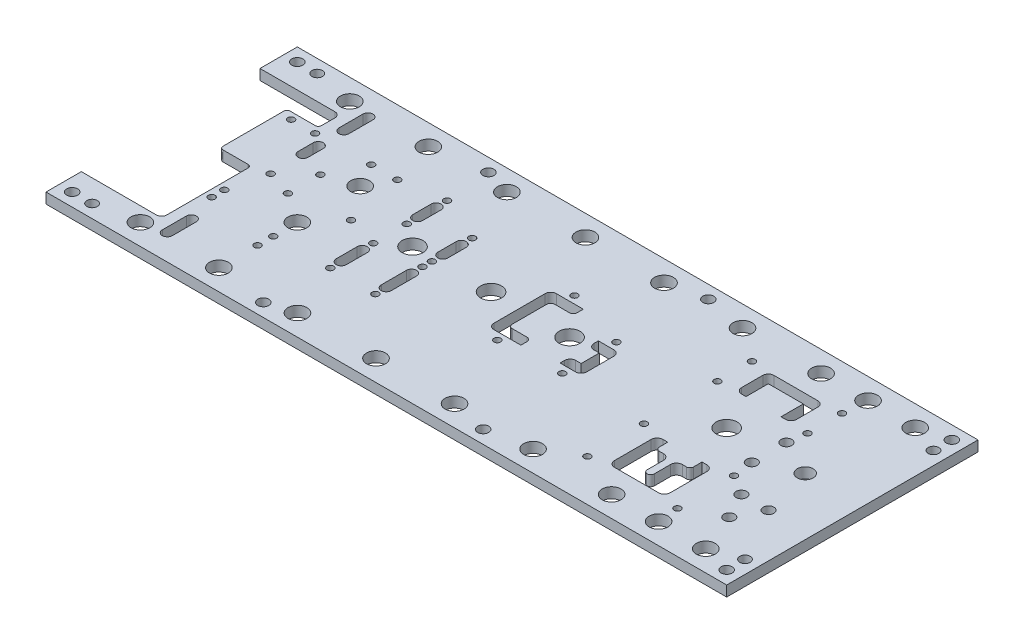
from build123d import *

# Parameters (mm, degrees)
SKETCH1_W                      = 650
SKETCH1_H                      = 240
BOSS_EXTRUDE1_DEPTH            = 10
CUT_EXTRUDE1_REACH             = 348.591
SKETCH2_R                      = 9
SKETCH2_R_2                    = 10
M6_CLEARANCE_HOLE1_D           = 6.4
M6_CLEARANCE_HOLE1_CSINK_D     = 6.45
M6_CLEARANCE_HOLE1_CSINK_ANGLE = 90
CUT_EXTRUDE2_REACH             = 348.591
FILLET1_R                      = 3
CUT_EXTRUDE3_REACH             = 348.591
SKETCH12_R                     = 5.113641914
SKETCH12_R_2                   = 7.613641914
CUT_EXTRUDE4_REACH             = 348.591
CUT_EXTRUDE5_REACH             = 348.591
CUT_EXTRUDE6_REACH             = 348.591
M10_CLEARANCE_HOLE1_D          = 10.5
F_10_0MM_DOWEL_HOLE1_D         = 10


with BuildPart() as part:
    # Sketch1 → Boss-Extrude1 (new body)
    with BuildSketch(Plane(origin=(0, 0, 0), x_dir=(1, 0, 0), z_dir=(0, 1, 0))):
        Rectangle(SKETCH1_W, SKETCH1_H)
    extrude(amount=-BOSS_EXTRUDE1_DEPTH)

    # Sketch2 → Cut-Extrude1 (cut, up to next)
    with BuildSketch(Plane.XZ.offset(10), mode=Mode.PRIVATE) as cut_extrude1_sk1:
        with Locations((-254.87, -100)):
            Circle(SKETCH2_R)
    cut_extrude1_tool1 = extrude(cut_extrude1_sk1.sketch, amount=-CUT_EXTRUDE1_REACH, mode=Mode.PRIVATE) & part.part
    # Sketch2 → Cut-Extrude1 (cut, up to next)
    with BuildSketch(Plane.XZ.offset(10), mode=Mode.PRIVATE) as cut_extrude1_sk2:
        with Locations((285, -100)):
            Circle(SKETCH2_R)
    cut_extrude1_tool2 = extrude(cut_extrude1_sk2.sketch, amount=-CUT_EXTRUDE1_REACH, mode=Mode.PRIVATE) & part.part
    # Sketch2 → Cut-Extrude1 (cut, up to next)
    with BuildSketch(Plane.XZ.offset(10), mode=Mode.PRIVATE) as cut_extrude1_sk3:
        with Locations((120.13, 100)):
            Circle(SKETCH2_R)
    cut_extrude1_tool3 = extrude(cut_extrude1_sk3.sketch, amount=-CUT_EXTRUDE1_REACH, mode=Mode.PRIVATE) & part.part
    # Sketch2 → Cut-Extrude1 (cut, up to next)
    with BuildSketch(Plane.XZ.offset(10), mode=Mode.PRIVATE) as cut_extrude1_sk4:
        with Locations((120.13, -100)):
            Circle(SKETCH2_R)
    cut_extrude1_tool4 = extrude(cut_extrude1_sk4.sketch, amount=-CUT_EXTRUDE1_REACH, mode=Mode.PRIVATE) & part.part
    # Sketch2 → Cut-Extrude1 (cut, up to next)
    with BuildSketch(Plane.XZ.offset(10), mode=Mode.PRIVATE) as cut_extrude1_sk5:
        with Locations((45.13, 100)):
            Circle(SKETCH2_R)
    cut_extrude1_tool5 = extrude(cut_extrude1_sk5.sketch, amount=-CUT_EXTRUDE1_REACH, mode=Mode.PRIVATE) & part.part
    # Sketch2 → Cut-Extrude1 (cut, up to next)
    with BuildSketch(Plane.XZ.offset(10), mode=Mode.PRIVATE) as cut_extrude1_sk6:
        with Locations((240, 100)):
            Circle(SKETCH2_R)
    cut_extrude1_tool6 = extrude(cut_extrude1_sk6.sketch, amount=-CUT_EXTRUDE1_REACH, mode=Mode.PRIVATE) & part.part
    # Sketch2 → Cut-Extrude1 (cut, up to next)
    with BuildSketch(Plane.XZ.offset(10), mode=Mode.PRIVATE) as cut_extrude1_sk7:
        with Locations((240, -100)):
            Circle(SKETCH2_R)
    cut_extrude1_tool7 = extrude(cut_extrude1_sk7.sketch, amount=-CUT_EXTRUDE1_REACH, mode=Mode.PRIVATE) & part.part
    # Sketch2 → Cut-Extrude1 (cut, up to next)
    with BuildSketch(Plane.XZ.offset(10), mode=Mode.PRIVATE) as cut_extrude1_sk8:
        with Locations((195.13, -100)):
            Circle(SKETCH2_R)
    cut_extrude1_tool8 = extrude(cut_extrude1_sk8.sketch, amount=-CUT_EXTRUDE1_REACH, mode=Mode.PRIVATE) & part.part
    # Sketch2 → Cut-Extrude1 (cut, up to next)
    with BuildSketch(Plane.XZ.offset(10), mode=Mode.PRIVATE) as cut_extrude1_sk9:
        with Locations((285, 100)):
            Circle(SKETCH2_R)
    cut_extrude1_tool9 = extrude(cut_extrude1_sk9.sketch, amount=-CUT_EXTRUDE1_REACH, mode=Mode.PRIVATE) & part.part
    # Sketch2 → Cut-Extrude1 (cut, up to next)
    with BuildSketch(Plane.XZ.offset(10), mode=Mode.PRIVATE) as cut_extrude1_sk10:
        with Locations((-104.87, -100)):
            Circle(SKETCH2_R)
    cut_extrude1_tool10 = extrude(cut_extrude1_sk10.sketch, amount=-CUT_EXTRUDE1_REACH, mode=Mode.PRIVATE) & part.part
    # Sketch2 → Cut-Extrude1 (cut, up to next)
    with BuildSketch(Plane.XZ.offset(10), mode=Mode.PRIVATE) as cut_extrude1_sk11:
        with Locations((-179.87, 100)):
            Circle(SKETCH2_R)
    cut_extrude1_tool11 = extrude(cut_extrude1_sk11.sketch, amount=-CUT_EXTRUDE1_REACH, mode=Mode.PRIVATE) & part.part
    # Sketch2 → Cut-Extrude1 (cut, up to next)
    with BuildSketch(Plane.XZ.offset(10), mode=Mode.PRIVATE) as cut_extrude1_sk12:
        with Locations((-179.87, -100)):
            Circle(SKETCH2_R)
    cut_extrude1_tool12 = extrude(cut_extrude1_sk12.sketch, amount=-CUT_EXTRUDE1_REACH, mode=Mode.PRIVATE) & part.part
    # Sketch2 → Cut-Extrude1 (cut, up to next)
    with BuildSketch(Plane.XZ.offset(10), mode=Mode.PRIVATE) as cut_extrude1_sk13:
        with Locations((45.13, -100)):
            Circle(SKETCH2_R)
    cut_extrude1_tool13 = extrude(cut_extrude1_sk13.sketch, amount=-CUT_EXTRUDE1_REACH, mode=Mode.PRIVATE) & part.part
    # Sketch2 → Cut-Extrude1 (cut, up to next)
    with BuildSketch(Plane.XZ.offset(10), mode=Mode.PRIVATE) as cut_extrude1_sk14:
        with Locations((-29.87, 100)):
            Circle(SKETCH2_R)
    cut_extrude1_tool14 = extrude(cut_extrude1_sk14.sketch, amount=-CUT_EXTRUDE1_REACH, mode=Mode.PRIVATE) & part.part
    # Sketch2 → Cut-Extrude1 (cut, up to next)
    with BuildSketch(Plane.XZ.offset(10), mode=Mode.PRIVATE) as cut_extrude1_sk15:
        with Locations((-29.87, -100)):
            Circle(SKETCH2_R)
    cut_extrude1_tool15 = extrude(cut_extrude1_sk15.sketch, amount=-CUT_EXTRUDE1_REACH, mode=Mode.PRIVATE) & part.part
    # Sketch2 → Cut-Extrude1 (cut, up to next)
    with BuildSketch(Plane.XZ.offset(10), mode=Mode.PRIVATE) as cut_extrude1_sk16:
        with Locations((-104.87, 100)):
            Circle(SKETCH2_R)
    cut_extrude1_tool16 = extrude(cut_extrude1_sk16.sketch, amount=-CUT_EXTRUDE1_REACH, mode=Mode.PRIVATE) & part.part
    # Sketch2 → Cut-Extrude1 (cut, up to next)
    with BuildSketch(Plane.XZ.offset(10), mode=Mode.PRIVATE) as cut_extrude1_sk17:
        with Locations((195.13, 100)):
            Circle(SKETCH2_R)
    cut_extrude1_tool17 = extrude(cut_extrude1_sk17.sketch, amount=-CUT_EXTRUDE1_REACH, mode=Mode.PRIVATE) & part.part
    # Sketch2 → Cut-Extrude1 (cut, up to next)
    with BuildSketch(Plane.XZ.offset(10), mode=Mode.PRIVATE) as cut_extrude1_sk18:
        with Locations((-254.87, 100)):
            Circle(SKETCH2_R)
    cut_extrude1_tool18 = extrude(cut_extrude1_sk18.sketch, amount=-CUT_EXTRUDE1_REACH, mode=Mode.PRIVATE) & part.part
    # Sketch2 → Cut-Extrude1 (cut, up to next)
    with BuildSketch(Plane.XZ.offset(10), mode=Mode.PRIVATE) as cut_extrude1_sk19:
        with Locations((195.13, -9.86)):
            Circle(SKETCH2_R_2)
    cut_extrude1_tool19 = extrude(cut_extrude1_sk19.sketch, amount=-CUT_EXTRUDE1_REACH, mode=Mode.PRIVATE) & part.part
    # Sketch2 → Cut-Extrude1 (cut, up to next)
    with BuildSketch(Plane.XZ.offset(10), mode=Mode.PRIVATE) as cut_extrude1_sk20:
        with Locations((45.13, -9.86)):
            Circle(SKETCH2_R_2)
    cut_extrude1_tool20 = extrude(cut_extrude1_sk20.sketch, amount=-CUT_EXTRUDE1_REACH, mode=Mode.PRIVATE) & part.part
    # Sketch2 → Cut-Extrude1 (cut, up to next)
    with BuildSketch(Plane.XZ.offset(10), mode=Mode.PRIVATE) as cut_extrude1_sk21:
        with Locations((-29.87, -9.86)):
            Circle(SKETCH2_R_2)
    cut_extrude1_tool21 = extrude(cut_extrude1_sk21.sketch, amount=-CUT_EXTRUDE1_REACH, mode=Mode.PRIVATE) & part.part
    # Sketch2 → Cut-Extrude1 (cut, up to next)
    with BuildSketch(Plane.XZ.offset(10), mode=Mode.PRIVATE) as cut_extrude1_sk22:
        with Locations((-104.87, -9.86)):
            Circle(SKETCH2_R_2)
    cut_extrude1_tool22 = extrude(cut_extrude1_sk22.sketch, amount=-CUT_EXTRUDE1_REACH, mode=Mode.PRIVATE) & part.part
    # Sketch2 → Cut-Extrude1 (cut, up to next)
    with BuildSketch(Plane.XZ.offset(10), mode=Mode.PRIVATE) as cut_extrude1_sk23:
        with Locations((-179.87, 25.14)):
            Circle(SKETCH2_R)
    cut_extrude1_tool23 = extrude(cut_extrude1_sk23.sketch, amount=-CUT_EXTRUDE1_REACH, mode=Mode.PRIVATE) & part.part
    # Sketch2 → Cut-Extrude1 (cut, up to next)
    with BuildSketch(Plane.XZ.offset(10), mode=Mode.PRIVATE) as cut_extrude1_sk24:
        with Locations((-179.87, -34.86)):
            Circle(SKETCH2_R)
    cut_extrude1_tool24 = extrude(cut_extrude1_sk24.sketch, amount=-CUT_EXTRUDE1_REACH, mode=Mode.PRIVATE) & part.part
    add(cut_extrude1_tool1.solids().sort_by_distance((-254.87, -10, -100))[0], mode=Mode.SUBTRACT)
    add(cut_extrude1_tool2.solids().sort_by_distance((285, -10, -100))[0], mode=Mode.SUBTRACT)
    add(cut_extrude1_tool3.solids().sort_by_distance((120.13, -10, 100))[0], mode=Mode.SUBTRACT)
    add(cut_extrude1_tool4.solids().sort_by_distance((120.13, -10, -100))[0], mode=Mode.SUBTRACT)
    add(cut_extrude1_tool5.solids().sort_by_distance((45.13, -10, 100))[0], mode=Mode.SUBTRACT)
    add(cut_extrude1_tool6.solids().sort_by_distance((240, -10, 100))[0], mode=Mode.SUBTRACT)
    add(cut_extrude1_tool7.solids().sort_by_distance((240, -10, -100))[0], mode=Mode.SUBTRACT)
    add(cut_extrude1_tool8.solids().sort_by_distance((195.13, -10, -100))[0], mode=Mode.SUBTRACT)
    add(cut_extrude1_tool9.solids().sort_by_distance((285, -10, 100))[0], mode=Mode.SUBTRACT)
    add(cut_extrude1_tool10.solids().sort_by_distance((-104.87, -10, -100))[0], mode=Mode.SUBTRACT)
    add(cut_extrude1_tool11.solids().sort_by_distance((-179.87, -10, 100))[0], mode=Mode.SUBTRACT)
    add(cut_extrude1_tool12.solids().sort_by_distance((-179.87, -10, -100))[0], mode=Mode.SUBTRACT)
    add(cut_extrude1_tool13.solids().sort_by_distance((45.13, -10, -100))[0], mode=Mode.SUBTRACT)
    add(cut_extrude1_tool14.solids().sort_by_distance((-29.87, -10, 100))[0], mode=Mode.SUBTRACT)
    add(cut_extrude1_tool15.solids().sort_by_distance((-29.87, -10, -100))[0], mode=Mode.SUBTRACT)
    add(cut_extrude1_tool16.solids().sort_by_distance((-104.87, -10, 100))[0], mode=Mode.SUBTRACT)
    add(cut_extrude1_tool17.solids().sort_by_distance((195.13, -10, 100))[0], mode=Mode.SUBTRACT)
    add(cut_extrude1_tool18.solids().sort_by_distance((-254.87, -10, 100))[0], mode=Mode.SUBTRACT)
    add(cut_extrude1_tool19.solids().sort_by_distance((195.13, -10, -9.86))[0], mode=Mode.SUBTRACT)
    add(cut_extrude1_tool20.solids().sort_by_distance((45.13, -10, -9.86))[0], mode=Mode.SUBTRACT)
    add(cut_extrude1_tool21.solids().sort_by_distance((-29.87, -10, -9.86))[0], mode=Mode.SUBTRACT)
    add(cut_extrude1_tool22.solids().sort_by_distance((-104.87, -10, -9.86))[0], mode=Mode.SUBTRACT)
    add(cut_extrude1_tool23.solids().sort_by_distance((-179.87, -10, 25.14))[0], mode=Mode.SUBTRACT)
    add(cut_extrude1_tool24.solids().sort_by_distance((-179.87, -10, -34.86))[0], mode=Mode.SUBTRACT)

    # M6 Clearance Hole1 (through all)
    with Locations(Plane(origin=(0, -10, 0), x_dir=(-1, 0, 0), z_dir=(0, -1, 0))):
        with Locations((-238.13, -26.14), (-152.13, -26.14), (-152.13, -80.14), (-238.13, -80.14), (-238.13, 77), (-152.13, 77), (-152.13, 44), (-238.13, 44), (-71.5, -23.486173195), (-71.5, 28.206173195), (-12.94, -26.986173195), (-12.94, 46.706173195), (83.37, 45.36), (83.37, 6.86), (126.37, 25.86), (126.37, 64.36), (83.37, -2.14), (126.37, -6.14), (126.37, -47.14), (83.37, -47.14), (156.12, 2.36), (208.37, -5.64), (208.37, 25.36), (192.37, 57.86), (167.37, 57.86), (179.87, -48.14), (179.87, -63.14), (241.62, -33.14), (241.62, -45.14), (232.87, 2.36), (267.87, 56.92), (245.000667118, 56.92)):
            CounterSinkHole(M6_CLEARANCE_HOLE1_D / 2, M6_CLEARANCE_HOLE1_CSINK_D / 2, counter_sink_angle=M6_CLEARANCE_HOLE1_CSINK_ANGLE)

    # Sketch8 → Cut-Extrude2 (cut, up to next)
    with BuildSketch(Plane(origin=(0, 0, 0), x_dir=(1, 0, 0), z_dir=(0, 1, 0)), mode=Mode.PRIVATE) as cut_extrude2_sk1:
        with BuildLine():
            Line((-325, -86.262387825), (-253.37, -86.262387825))
            ThreePointArc((-253.37, -86.262387825), (-249.834466094, -84.797921731), (-248.37, -81.262387825))
            Line((-248.37, -81.262387825), (-248.37, -3.64))
            ThreePointArc((-248.37, -3.64), (-249.248679656, -1.518679656), (-251.37, -0.64))
            Line((-251.37, -0.64), (-278.37, -0.64))
            Line((-278.37, -0.64), (-278.37, 63.48))
            Line((-278.37, 63.48), (-248.37, 63.48))
            Line((-248.37, 63.48), (-248.37, 79.36))
            ThreePointArc((-248.37, 79.36), (-249.834466094, 82.895533906), (-253.37, 84.36))
            Line((-253.37, 84.36), (-325, 84.36))
            Line((-325, 84.36), (-325, -86.262387825))
        make_face()
    cut_extrude2_tool1 = extrude(cut_extrude2_sk1.sketch, amount=-CUT_EXTRUDE2_REACH, mode=Mode.PRIVATE) & part.part
    add(cut_extrude2_tool1.solids().sort_by_distance((-290.753811, 0, 6.541566))[0], mode=Mode.SUBTRACT)

    # Fillet1
    fillet1_edges = [part.edges().sort_by_distance(p)[0] for p in [
        (-248.37, -5, -63.48),
        (-278.37, -5, -63.48),
        (-278.37, -5, 0.64),
    ]]
    fillet(fillet1_edges, radius=FILLET1_R)

    # Sketch12 → Cut-Extrude3 (cut, up to next)
    with BuildSketch(Plane.XZ.offset(10), mode=Mode.PRIVATE) as cut_extrude3_sk1:
        with Locations((270.13, 62.64)):
            Circle(SKETCH12_R)
    cut_extrude3_tool1 = extrude(cut_extrude3_sk1.sketch, amount=-CUT_EXTRUDE3_REACH, mode=Mode.PRIVATE) & part.part
    # Sketch12 → Cut-Extrude3 (cut, up to next)
    with BuildSketch(Plane.XZ.offset(10), mode=Mode.PRIVATE) as cut_extrude3_sk2:
        with Locations((283.13, 38.14)):
            Circle(SKETCH12_R)
    cut_extrude3_tool2 = extrude(cut_extrude3_sk2.sketch, amount=-CUT_EXTRUDE3_REACH, mode=Mode.PRIVATE) & part.part
    # Sketch12 → Cut-Extrude3 (cut, up to next)
    with BuildSketch(Plane.XZ.offset(10), mode=Mode.PRIVATE) as cut_extrude3_sk3:
        with Locations((257.13, 38.14)):
            Circle(SKETCH12_R)
    cut_extrude3_tool3 = extrude(cut_extrude3_sk3.sketch, amount=-CUT_EXTRUDE3_REACH, mode=Mode.PRIVATE) & part.part
    # Sketch12 → Cut-Extrude3 (cut, up to next)
    with BuildSketch(Plane.XZ.offset(10), mode=Mode.PRIVATE) as cut_extrude3_sk4:
        with Locations((270.13, -9.86)):
            Circle(SKETCH12_R_2)
    cut_extrude3_tool4 = extrude(cut_extrude3_sk4.sketch, amount=-CUT_EXTRUDE3_REACH, mode=Mode.PRIVATE) & part.part
    # Sketch12 → Cut-Extrude3 (cut, up to next)
    with BuildSketch(Plane.XZ.offset(10), mode=Mode.PRIVATE) as cut_extrude3_sk5:
        with Locations((235.63, -26.36)):
            Circle(SKETCH12_R)
    cut_extrude3_tool5 = extrude(cut_extrude3_sk5.sketch, amount=-CUT_EXTRUDE3_REACH, mode=Mode.PRIVATE) & part.part
    # Sketch12 → Cut-Extrude3 (cut, up to next)
    with BuildSketch(Plane.XZ.offset(10), mode=Mode.PRIVATE) as cut_extrude3_sk6:
        with Locations((235.63, 6.64)):
            Circle(SKETCH12_R)
    cut_extrude3_tool6 = extrude(cut_extrude3_sk6.sketch, amount=-CUT_EXTRUDE3_REACH, mode=Mode.PRIVATE) & part.part
    # Sketch12 → Cut-Extrude3 (cut, up to next)
    with BuildSketch(Plane.XZ.offset(10), mode=Mode.PRIVATE) as cut_extrude3_sk7:
        with BuildLine():
            Line((211.837653611, -45.067653611), (211.837653611, -66.347653611))
            Line((211.837653611, -66.347653611), (178.422346389, -66.347653611))
            Line((178.422346389, -66.347653611), (178.422346389, -45.067653611))
            Line((178.422346389, -45.067653611), (174.13, -45.067653611))
            ThreePointArc((174.13, -45.067653611), (170.38774598, -46.61774598), (168.837653611, -50.36))
            Line((168.837653611, -50.36), (168.837653611, -70.64))
            ThreePointArc((168.837653611, -70.64), (170.38774598, -74.38225402), (174.13, -75.932346389))
            Line((174.13, -75.932346389), (195.13, -75.932346389))
            Line((195.13, -75.932346389), (216.13, -75.932346389))
            ThreePointArc((216.13, -75.932346389), (219.87225402, -74.38225402), (221.422346389, -70.64))
            Line((221.422346389, -70.64), (221.422346389, -50.36))
            ThreePointArc((221.422346389, -50.36), (219.87225402, -46.61774598), (216.13, -45.067653611))
            Line((216.13, -45.067653611), (211.837653611, -45.067653611))
        make_face()
    cut_extrude3_tool7 = extrude(cut_extrude3_sk7.sketch, amount=-CUT_EXTRUDE3_REACH, mode=Mode.PRIVATE) & part.part
    # Sketch12 → Cut-Extrude3 (cut, up to next)
    with BuildSketch(Plane.XZ.offset(10), mode=Mode.PRIVATE) as cut_extrude3_sk8:
        with BuildLine():
            Line((211.516358086, 30.026358086), (216.13, 30.026358086))
            ThreePointArc((216.13, 30.026358086), (220.099444264, 31.670555736), (221.743641914, 35.64))
            Line((221.743641914, 35.64), (221.743641914, 53.14))
            Line((221.743641914, 53.14), (221.743641914, 70.64))
            ThreePointArc((221.743641914, 70.64), (220.099444264, 74.609444264), (216.13, 76.253641914))
            Line((216.13, 76.253641914), (174.13, 76.253641914))
            ThreePointArc((174.13, 76.253641914), (170.160555736, 74.609444264), (168.516358086, 70.64))
            Line((168.516358086, 70.64), (168.516358086, 35.64))
            ThreePointArc((168.516358086, 35.64), (170.160555736, 31.670555736), (174.13, 30.026358086))
            Line((174.13, 30.026358086), (178.743641914, 30.026358086))
            Line((178.743641914, 30.026358086), (178.743641914, 38.14))
            ThreePointArc((178.743641914, 38.14), (179.735483234, 40.534516766), (182.13, 41.526358086))
            Line((182.13, 41.526358086), (186.13, 41.526358086))
            ThreePointArc((186.13, 41.526358086), (190.099444264, 43.170555736), (191.743641914, 47.14))
            Line((191.743641914, 47.14), (191.743641914, 62.64))
            ThreePointArc((191.743641914, 62.64), (195.13, 66.026358086), (198.516358086, 62.64))
            Line((198.516358086, 62.64), (198.516358086, 47.14))
            ThreePointArc((198.516358086, 47.14), (200.160555736, 43.170555736), (204.13, 41.526358086))
            Line((204.13, 41.526358086), (208.13, 41.526358086))
            ThreePointArc((208.13, 41.526358086), (210.524516766, 40.534516766), (211.516358086, 38.14))
            Line((211.516358086, 38.14), (211.516358086, 30.026358086))
        make_face()
    cut_extrude3_tool8 = extrude(cut_extrude3_sk8.sketch, amount=-CUT_EXTRUDE3_REACH, mode=Mode.PRIVATE) & part.part
    add(cut_extrude3_tool1.solids().sort_by_distance((270.13, -10, 62.64))[0], mode=Mode.SUBTRACT)
    add(cut_extrude3_tool2.solids().sort_by_distance((283.13, -10, 38.14))[0], mode=Mode.SUBTRACT)
    add(cut_extrude3_tool3.solids().sort_by_distance((257.13, -10, 38.14))[0], mode=Mode.SUBTRACT)
    add(cut_extrude3_tool4.solids().sort_by_distance((270.13, -10, -9.86))[0], mode=Mode.SUBTRACT)
    add(cut_extrude3_tool5.solids().sort_by_distance((235.63, -10, -26.36))[0], mode=Mode.SUBTRACT)
    add(cut_extrude3_tool6.solids().sort_by_distance((235.63, -10, 6.64))[0], mode=Mode.SUBTRACT)
    add(cut_extrude3_tool7.solids().sort_by_distance((205.63, -10, -75.32261))[0], mode=Mode.SUBTRACT)
    add(cut_extrude3_tool8.solids().sort_by_distance((206.13, -10, 42.231348))[0], mode=Mode.SUBTRACT)

    # Sketch13 → Cut-Extrude4 (cut, up to next)
    with BuildSketch(Plane.XZ.offset(10), mode=Mode.PRIVATE) as cut_extrude4_sk1:
        with BuildLine():
            Line((61.837653611, 15.932346389), (61.837653611, 11.64))
            ThreePointArc((61.837653611, 11.64), (63.38774598, 7.89774598), (67.13, 6.347653611))
            Line((67.13, 6.347653611), (72.337653611, 6.347653611))
            Line((72.337653611, 6.347653611), (72.337653611, -11.067653611))
            Line((72.337653611, -11.067653611), (67.13, -11.067653611))
            ThreePointArc((67.13, -11.067653611), (63.38774598, -12.61774598), (61.837653611, -16.36))
            Line((61.837653611, -16.36), (61.837653611, -20.652346389))
            Line((61.837653611, -20.652346389), (76.63, -20.652346389))
            ThreePointArc((76.63, -20.652346389), (80.37225402, -19.10225402), (81.922346389, -15.36))
            Line((81.922346389, -15.36), (81.922346389, -2.36))
            Line((81.922346389, -2.36), (81.922346389, 10.64))
            ThreePointArc((81.922346389, 10.64), (80.37225402, 14.38225402), (76.63, 15.932346389))
            Line((76.63, 15.932346389), (61.837653611, 15.932346389))
        make_face()
    cut_extrude4_tool1 = extrude(cut_extrude4_sk1.sketch, amount=-CUT_EXTRUDE4_REACH, mode=Mode.PRIVATE) & part.part
    # Sketch13 → Cut-Extrude4 (cut, up to next)
    with BuildSketch(Plane.XZ.offset(10), mode=Mode.PRIVATE) as cut_extrude4_sk2:
        with BuildLine():
            Line((2.63, -39.652346389), (28.422346389, -39.652346389))
            Line((28.422346389, -39.652346389), (28.422346389, -33.86))
            ThreePointArc((28.422346389, -33.86), (27.311593849, -31.178406151), (24.63, -30.067653611))
            Line((24.63, -30.067653611), (10.63, -30.067653611))
            ThreePointArc((10.63, -30.067653611), (8.00829299, -28.98170701), (6.922346389, -26.36))
            Line((6.922346389, -26.36), (6.922346389, 6.64))
            ThreePointArc((6.922346389, 6.64), (8.00829299, 9.26170701), (10.63, 10.347653611))
            Line((10.63, 10.347653611), (24.63, 10.347653611))
            ThreePointArc((24.63, 10.347653611), (27.311593849, 11.458406151), (28.422346389, 14.14))
            Line((28.422346389, 14.14), (28.422346389, 19.932346389))
            Line((28.422346389, 19.932346389), (2.63, 19.932346389))
            ThreePointArc((2.63, 19.932346389), (-1.11225402, 18.38225402), (-2.662346389, 14.64))
            Line((-2.662346389, 14.64), (-2.662346389, -13.23))
            Line((-2.662346389, -13.23), (-2.662346389, -34.36))
            ThreePointArc((-2.662346389, -34.36), (-1.11225402, -38.10225402), (2.63, -39.652346389))
        make_face()
    cut_extrude4_tool2 = extrude(cut_extrude4_sk2.sketch, amount=-CUT_EXTRUDE4_REACH, mode=Mode.PRIVATE) & part.part
    add(cut_extrude4_tool1.solids().sort_by_distance((73.54007, -10, -2.36))[0], mode=Mode.SUBTRACT)
    add(cut_extrude4_tool2.solids().sort_by_distance((-0.637039, -10, -37.627039))[0], mode=Mode.SUBTRACT)

    # Sketch14 → Cut-Extrude5 (cut, up to next)
    with BuildSketch(Plane.XZ.offset(10), mode=Mode.PRIVATE) as cut_extrude5_sk1:
        with BuildLine():
            Line((-88.162346389, -17.31), (-88.162346389, -34.91))
            ThreePointArc((-88.162346389, -34.91), (-83.37, -39.702346389), (-78.577653611, -34.91))
            Line((-78.577653611, -34.91), (-78.577653611, -26.11))
            Line((-78.577653611, -26.11), (-78.577653611, -17.31))
            ThreePointArc((-78.577653611, -17.31), (-83.37, -12.517653611), (-88.162346389, -17.31))
        make_face()
    cut_extrude5_tool1 = extrude(cut_extrude5_sk1.sketch, amount=-CUT_EXTRUDE5_REACH, mode=Mode.PRIVATE) & part.part
    # Sketch14 → Cut-Extrude5 (cut, up to next)
    with BuildSketch(Plane.XZ.offset(10), mode=Mode.PRIVATE) as cut_extrude5_sk2:
        with BuildLine():
            Line((-78.577653611, 12.59), (-78.577653611, 24.64))
            Line((-78.577653611, 24.64), (-78.577653611, 36.69))
            ThreePointArc((-78.577653611, 36.69), (-83.37, 41.482346389), (-88.162346389, 36.69))
            Line((-88.162346389, 36.69), (-88.162346389, 12.59))
            ThreePointArc((-88.162346389, 12.59), (-83.37, 7.797653611), (-78.577653611, 12.59))
        make_face()
    cut_extrude5_tool2 = extrude(cut_extrude5_sk2.sketch, amount=-CUT_EXTRUDE5_REACH, mode=Mode.PRIVATE) & part.part
    # Sketch14 → Cut-Extrude5 (cut, up to next)
    with BuildSketch(Plane.XZ.offset(10), mode=Mode.PRIVATE) as cut_extrude5_sk3:
        with BuildLine():
            Line((-131.232166649, 36.69), (-131.232166649, 16.59))
            ThreePointArc((-131.232166649, 16.59), (-126.37, 11.727833351), (-121.507833351, 16.59))
            Line((-121.507833351, 16.59), (-121.507833351, 26.64))
            Line((-121.507833351, 26.64), (-121.507833351, 36.69))
            ThreePointArc((-121.507833351, 36.69), (-126.37, 41.552166649), (-131.232166649, 36.69))
        make_face()
    cut_extrude5_tool3 = extrude(cut_extrude5_sk3.sketch, amount=-CUT_EXTRUDE5_REACH, mode=Mode.PRIVATE) & part.part
    # Sketch14 → Cut-Extrude5 (cut, up to next)
    with BuildSketch(Plane.XZ.offset(10), mode=Mode.PRIVATE) as cut_extrude5_sk4:
        with BuildLine():
            Line((-131.162346389, -36.31), (-131.162346389, -53.91))
            ThreePointArc((-131.162346389, -53.91), (-126.37, -58.702346389), (-121.577653611, -53.91))
            Line((-121.577653611, -53.91), (-121.577653611, -45.11))
            Line((-121.577653611, -45.11), (-121.577653611, -36.31))
            ThreePointArc((-121.577653611, -36.31), (-126.37, -31.517653611), (-131.162346389, -36.31))
        make_face()
    cut_extrude5_tool4 = extrude(cut_extrude5_sk4.sketch, amount=-CUT_EXTRUDE5_REACH, mode=Mode.PRIVATE) & part.part
    add(cut_extrude5_tool1.solids().sort_by_distance((-83.37, -10, -26.11))[0], mode=Mode.SUBTRACT)
    add(cut_extrude5_tool2.solids().sort_by_distance((-83.37, -10, 24.64))[0], mode=Mode.SUBTRACT)
    add(cut_extrude5_tool3.solids().sort_by_distance((-126.37, -10, 26.64))[0], mode=Mode.SUBTRACT)
    add(cut_extrude5_tool4.solids().sort_by_distance((-126.37, -10, -45.11))[0], mode=Mode.SUBTRACT)

    # Sketch15 → Cut-Extrude6 (cut, up to next)
    with BuildSketch(Plane.XZ.offset(10), mode=Mode.PRIVATE) as cut_extrude6_sk1:
        with BuildLine():
            Line((-228.577653611, -95.77), (-228.577653611, -84.32))
            Line((-228.577653611, -84.32), (-228.577653611, -72.87))
            ThreePointArc((-228.577653611, -72.87), (-233.37, -68.077653611), (-238.162346389, -72.87))
            Line((-238.162346389, -72.87), (-238.162346389, -95.77))
            ThreePointArc((-238.162346389, -95.77), (-233.37, -100.562346389), (-228.577653611, -95.77))
        make_face()
    cut_extrude6_tool1 = extrude(cut_extrude6_sk1.sketch, amount=-CUT_EXTRUDE6_REACH, mode=Mode.PRIVATE) & part.part
    # Sketch15 → Cut-Extrude6 (cut, up to next)
    with BuildSketch(Plane.XZ.offset(10), mode=Mode.PRIVATE) as cut_extrude6_sk2:
        with BuildLine():
            Line((-238.162346389, -33.86), (-238.162346389, -48.36))
            ThreePointArc((-238.162346389, -48.36), (-233.37, -53.152346389), (-228.577653611, -48.36))
            Line((-228.577653611, -48.36), (-228.577653611, -41.11))
            Line((-228.577653611, -41.11), (-228.577653611, -33.86))
            ThreePointArc((-228.577653611, -33.86), (-233.37, -29.067653611), (-238.162346389, -33.86))
        make_face()
    cut_extrude6_tool2 = extrude(cut_extrude6_sk2.sketch, amount=-CUT_EXTRUDE6_REACH, mode=Mode.PRIVATE) & part.part
    # Sketch15 → Cut-Extrude6 (cut, up to next)
    with BuildSketch(Plane.XZ.offset(10), mode=Mode.PRIVATE) as cut_extrude6_sk3:
        with BuildLine():
            Line((-238.162346389, 95.77), (-238.162346389, 72.87))
            ThreePointArc((-238.162346389, 72.87), (-233.37, 68.077653611), (-228.577653611, 72.87))
            Line((-228.577653611, 72.87), (-228.577653611, 84.32))
            Line((-228.577653611, 84.32), (-228.577653611, 95.77))
            ThreePointArc((-228.577653611, 95.77), (-233.37, 100.562346389), (-238.162346389, 95.77))
        make_face()
    cut_extrude6_tool3 = extrude(cut_extrude6_sk3.sketch, amount=-CUT_EXTRUDE6_REACH, mode=Mode.PRIVATE) & part.part
    add(cut_extrude6_tool1.solids().sort_by_distance((-233.37, -10, -84.32))[0], mode=Mode.SUBTRACT)
    add(cut_extrude6_tool2.solids().sort_by_distance((-233.37, -10, -41.11))[0], mode=Mode.SUBTRACT)
    add(cut_extrude6_tool3.solids().sort_by_distance((-233.37, -10, 84.32))[0], mode=Mode.SUBTRACT)

    # M10 Clearance Hole1 (through all)
    with Locations(Plane(origin=(0, -10, 0), x_dir=(-1, 0, 0), z_dir=(0, -1, 0))):
        with Locations((-312.5, 107.5), (-80, 107.5), (130, 107.5), (312.5, 107.5), (312.5, -107.5), (130, -107.5), (-80, -107.5), (-312.5, -107.5)):
            Hole(M10_CLEARANCE_HOLE1_D / 2)

    # Ø10.0mm Dowel Hole1 (through all)
    with Locations(Plane(origin=(0, -10, 0), x_dir=(-1, 0, 0), z_dir=(0, -1, 0))):
        with Locations((-312.5, 90), (-312.5, -90), (293.5, -107.5), (293.5, 107.5)):
            Hole(F_10_0MM_DOWEL_HOLE1_D / 2)


solid = part.part
